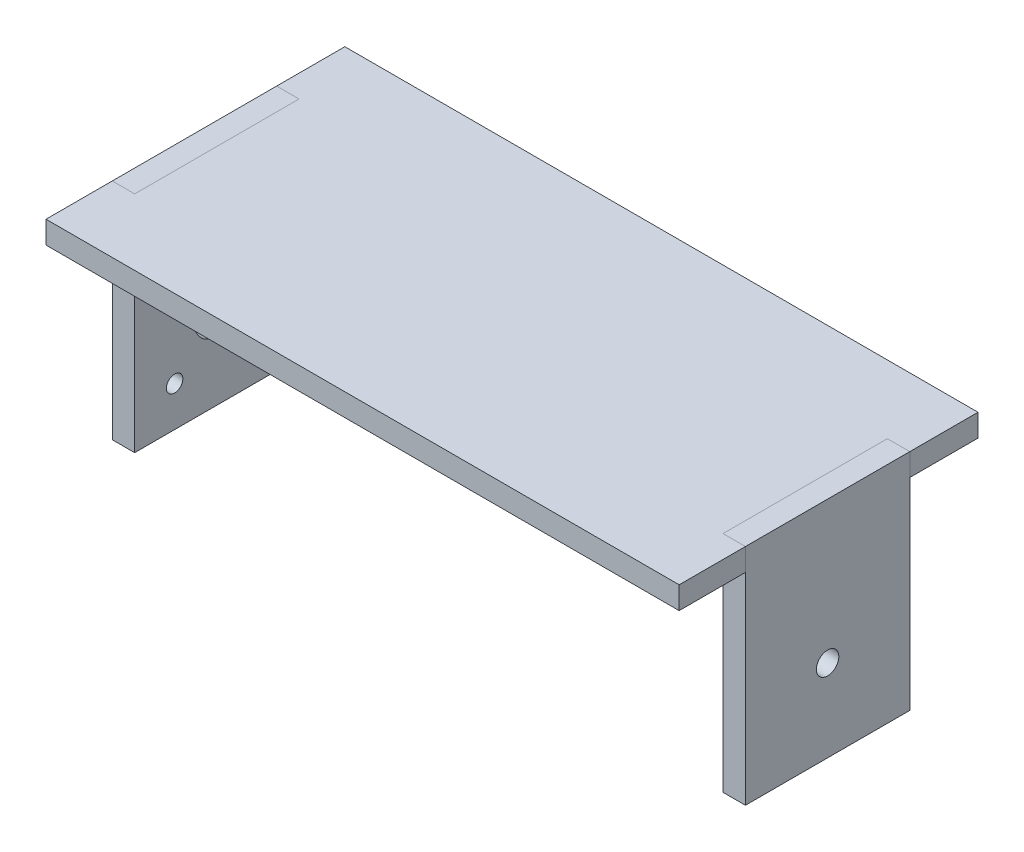
from build123d import *

# Parameters (mm, degrees)
BOSS_EXTRUDE1_DEPTH         = 3
SKETCH1_3_W                 = 3
SKETCH1_3_H                 = 22
BOSS_EXTRUDE2_DEPTH         = 30
BOSS_EXTRUDE2_2_DEPTH       = 30
SKETCH2_R                   = 3
SKETCH2_R_2                 = 1.1
CUT_EXTRUDE1_DEPTH          = 3
SKETCH3_R                   = 1.5
CUT_EXTRUDE2_DEPTH          = 3
CIRPATTERN1_COUNT           = 4
BODY_MOVE_COPY1_START       = 19.870550162
BODY_MOVE_COPY1_OUTLINE_W   = 84.75
BODY_MOVE_COPY1_OUTLINE_H   = 3
BODY_MOVE_COPY1_DEPTH       = 0.258899676
BODY_MOVE_COPY1_START_2     = -20.129449838
BODY_MOVE_COPY1_2_OUTLINE_W = 84.75
BODY_MOVE_COPY1_2_OUTLINE_H = 3
BODY_MOVE_COPY1_2_DEPTH     = 0.258899676


# Read off the part's stored shape, not the designer's step: Body-Move/Copy1
with BuildPart() as part:
    # Sketch1 → Boss-Extrude1 (new body)
    with BuildSketch(Plane(origin=(0, 0, 0), x_dir=(1, 0, 0), z_dir=(0, 1, 0))):
        Polygon((42.126618123, 19.870550162), (-42.623381877, 19.870550162), (-42.623381877, 11), (-39.623381877, 11), (-39.623381877, -11), (-42.623381877, -11), (-42.623381877, -20.129449838), (42.126618123, -20.129449838), (42.126618123, -11), (39.126618123, -11), (39.126618123, 11), (42.126618123, 11), align=None)
    extrude(amount=-BOSS_EXTRUDE1_DEPTH)

    # Body-Move/Copy1 outline → Body-Move/Copy1 (cut)
    with BuildSketch(Plane.XY.offset(BODY_MOVE_COPY1_START)):
        with Locations((-0.248381877, -1.5)):
            Rectangle(BODY_MOVE_COPY1_OUTLINE_W, BODY_MOVE_COPY1_OUTLINE_H)
    extrude(amount=BODY_MOVE_COPY1_DEPTH, mode=Mode.SUBTRACT)

    # Body-Move_Copy1 2 outline → Body-Move_Copy1 2 (add)
    with BuildSketch(Plane.XY.offset(BODY_MOVE_COPY1_START_2)):
        with Locations((-0.248381877, -1.5)):
            Rectangle(BODY_MOVE_COPY1_2_OUTLINE_W, BODY_MOVE_COPY1_2_OUTLINE_H)
    extrude(amount=BODY_MOVE_COPY1_2_DEPTH)


with BuildPart() as body_2:
    # Sketch1<3> → Boss-Extrude2 (new body)
    with BuildSketch(Plane(origin=(0, 0, 0), x_dir=(1, 0, 0), z_dir=(0, 1, 0))):
        with Locations((-41.123381877, 0)):
            Rectangle(SKETCH1_3_W, SKETCH1_3_H)
    extrude(amount=-BOSS_EXTRUDE2_DEPTH)

    # Sketch2 → Cut-Extrude1 (cut)
    with BuildSketch(Plane.ZY.offset(42.623381877)):
        with Locations((0, -19)):
            Circle(SKETCH2_R)
        with Locations((-5.656854249, -24.656854249)):
            Circle(SKETCH2_R_2)
    cut_extrude1 = extrude(amount=-CUT_EXTRUDE1_DEPTH, mode=Mode.SUBTRACT)

    # CirPattern1: Cut-Extrude1 ×4 about axis
    cirpattern1_axis = Axis((0, -19, 0), (1, 0, 0))
    for i in range(1, CIRPATTERN1_COUNT):
        add(cut_extrude1.rotate(cirpattern1_axis, i * 360 / CIRPATTERN1_COUNT), mode=Mode.SUBTRACT)


with BuildPart() as body_3:
    # Sketch1<3> → Boss-Extrude2 2 (new body)
    with BuildSketch(Plane(origin=(0, 0, 0), x_dir=(1, 0, 0), z_dir=(0, 1, 0))):
        with Locations((40.626618123, 0)):
            Rectangle(SKETCH1_3_W, SKETCH1_3_H)
    extrude(amount=-BOSS_EXTRUDE2_2_DEPTH)

    # Sketch3 → Cut-Extrude2 (cut)
    with BuildSketch(Plane(origin=(42.126618123, 0, 0), x_dir=(0, 0, -1), z_dir=(1, 0, 0))):
        with Locations((0, -19)):
            Circle(SKETCH3_R)
    extrude(amount=-CUT_EXTRUDE2_DEPTH, mode=Mode.SUBTRACT)


solid = Compound([part.part, body_2.part, body_3.part])
